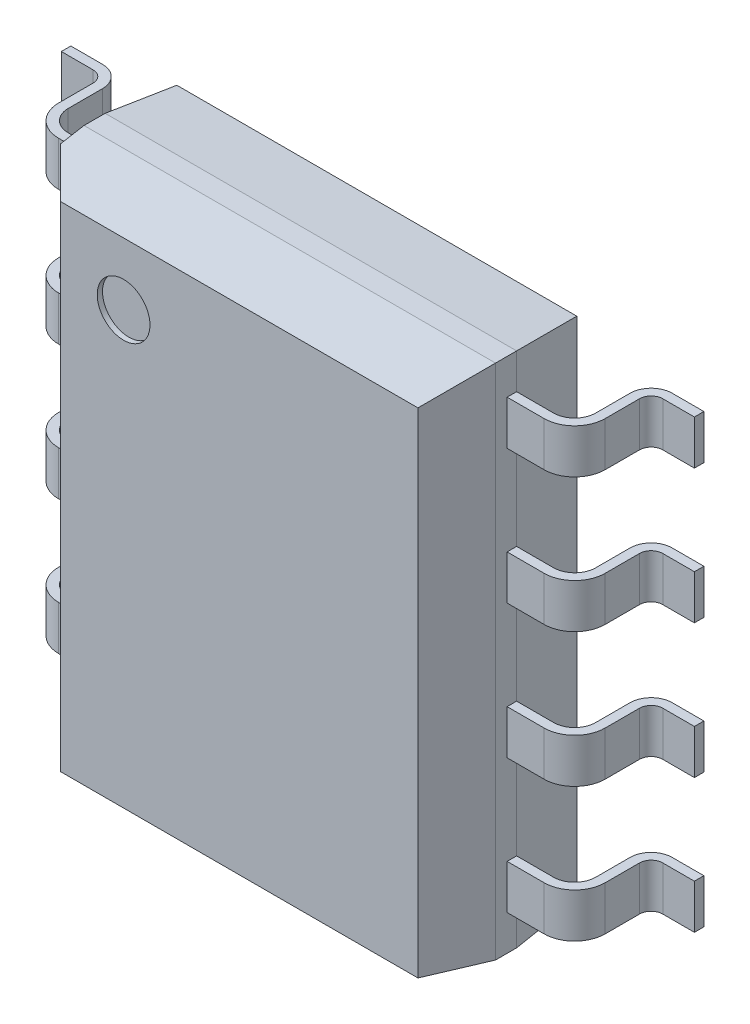
from build123d import *
from OCP.BRepFilletAPI import BRepFilletAPI_MakeChamfer

# Parameters (mm, degrees)
ESQUISSE2_W              = 3.9
ESQUISSE2_H              = 4.9
CORP_DEPTH               = 1.45
PIN_1_DEPTH              = 0.21
R_P_TITION_PIN_1_4_COUNT = 4
R_P_TITION_PIN_1_4_PITCH = 1.27
SYM_TRIE1_COPY_1_DEPTH   = 0.21
SYM_TRIE1_COPY_2_DEPTH   = 0.21
SYM_TRIE1_COPY_3_DEPTH   = 0.21
CHANFREIN4_SIZE          = 0.625
CHANFREIN4_SIZE2         = 0.110204363
CHANFREIN5_SIZE          = 0.625
CHANFREIN5_SIZE_2        = 0.054680415
ESQUISSE8_R              = 0.25
ENL_V_MAT_EXTRU_1_DEPTH  = 0.05
CHANFREIN7_SIZE          = 0.4


with BuildPart() as part:
    # Esquisse2 → corp (new body)
    with BuildSketch(Plane.XY.offset(0.1)):
        Rectangle(ESQUISSE2_W, ESQUISSE2_H)
    extrude(amount=CORP_DEPTH)

    # Esquisse6 → pin 1 (add, symmetric)
    with BuildSketch(Plane(origin=(0, 1.905, 0), x_dir=(-1, 0, 0), z_dir=(0, 1, 0))):
        with BuildLine():
            Line((1.95, 0.725), (2.3, 0.725))
            ThreePointArc((2.3, 0.725), (2.441421356, 0.666421356), (2.5, 0.525))
            Line((2.5, 0.525), (2.5, 0.2))
            ThreePointArc((2.5, 0.2), (2.558578644, 0.058578644), (2.7, 0))
            Line((2.7, 0), (3, 0))
            Line((3, 0), (3, 0.09))
            Line((3, 0.09), (2.7, 0.09))
            ThreePointArc((2.7, 0.09), (2.622218254, 0.122218254), (2.59, 0.2))
            Line((2.59, 0.2), (2.59, 0.525))
            ThreePointArc((2.59, 0.525), (2.505060967, 0.730060967), (2.3, 0.815))
            Line((2.3, 0.815), (1.95, 0.815))
            Line((1.95, 0.815), (1.95, 0.725))
        make_face()
    pin_1 = extrude(amount=PIN_1_DEPTH, both=True)

    # Répétition pin 1-4: pin 1 ×4
    with Locations(*[(0, -i * R_P_TITION_PIN_1_4_PITCH, 0) for i in range(1, R_P_TITION_PIN_1_4_COUNT)]):
        add(pin_1)

    # Symétrie1: pin 1 across plane
    add(pin_1.mirror(Plane(origin=(0, 0, 0), x_dir=(0, 0, 1), z_dir=(1, 0, 0))))

    # Symétrie1 copy 1 sketch → Symétrie1 copy 1 (add, symmetric)
    with BuildSketch(Plane(origin=(0, 0.635, 0), x_dir=(1, 0, 0), z_dir=(0, 1, 0))):
        with BuildLine():
            Line((1.95, -0.725), (2.3, -0.725))
            ThreePointArc((2.3, -0.725), (2.441421356, -0.666421356), (2.5, -0.525))
            Line((2.5, -0.525), (2.5, -0.2))
            ThreePointArc((2.5, -0.2), (2.558578644, -0.058578644), (2.7, 0))
            Line((2.7, 0), (3, 0))
            Line((3, 0), (3, -0.09))
            Line((3, -0.09), (2.7, -0.09))
            ThreePointArc((2.7, -0.09), (2.622218254, -0.122218254), (2.59, -0.2))
            Line((2.59, -0.2), (2.59, -0.525))
            ThreePointArc((2.59, -0.525), (2.505060967, -0.730060967), (2.3, -0.815))
            Line((2.3, -0.815), (1.95, -0.815))
            Line((1.95, -0.815), (1.95, -0.725))
        make_face()
    extrude(amount=SYM_TRIE1_COPY_1_DEPTH, both=True)

    # Symétrie1 copy 2 sketch → Symétrie1 copy 2 (add, symmetric)
    with BuildSketch(Plane(origin=(0, -0.635, 0), x_dir=(1, 0, 0), z_dir=(0, 1, 0))):
        with BuildLine():
            Line((1.95, -0.725), (2.3, -0.725))
            ThreePointArc((2.3, -0.725), (2.441421356, -0.666421356), (2.5, -0.525))
            Line((2.5, -0.525), (2.5, -0.2))
            ThreePointArc((2.5, -0.2), (2.558578644, -0.058578644), (2.7, 0))
            Line((2.7, 0), (3, 0))
            Line((3, 0), (3, -0.09))
            Line((3, -0.09), (2.7, -0.09))
            ThreePointArc((2.7, -0.09), (2.622218254, -0.122218254), (2.59, -0.2))
            Line((2.59, -0.2), (2.59, -0.525))
            ThreePointArc((2.59, -0.525), (2.505060967, -0.730060967), (2.3, -0.815))
            Line((2.3, -0.815), (1.95, -0.815))
            Line((1.95, -0.815), (1.95, -0.725))
        make_face()
    extrude(amount=SYM_TRIE1_COPY_2_DEPTH, both=True)

    # Symétrie1 copy 3 sketch → Symétrie1 copy 3 (add, symmetric)
    with BuildSketch(Plane(origin=(0, -1.905, 0), x_dir=(1, 0, 0), z_dir=(0, 1, 0))):
        with BuildLine():
            Line((1.95, -0.725), (2.3, -0.725))
            ThreePointArc((2.3, -0.725), (2.441421356, -0.666421356), (2.5, -0.525))
            Line((2.5, -0.525), (2.5, -0.2))
            ThreePointArc((2.5, -0.2), (2.558578644, -0.058578644), (2.7, 0))
            Line((2.7, 0), (3, 0))
            Line((3, 0), (3, -0.09))
            Line((3, -0.09), (2.7, -0.09))
            ThreePointArc((2.7, -0.09), (2.622218254, -0.122218254), (2.59, -0.2))
            Line((2.59, -0.2), (2.59, -0.525))
            ThreePointArc((2.59, -0.525), (2.505060967, -0.730060967), (2.3, -0.815))
            Line((2.3, -0.815), (1.95, -0.815))
            Line((1.95, -0.815), (1.95, -0.725))
        make_face()
    extrude(amount=SYM_TRIE1_COPY_3_DEPTH, both=True)

    # Chanfrein4: one chamfer whose edges measure the first distance from different faces: ONE call of the kernel's chamfer builder (chamfer() names one face for all edges)
    chanfrein4_edges_1 = [part.edges().sort_by_distance(p)[0] for p in [
        (1.95, 0, 1.55),
    ]]
    chanfrein4_side_1 = [part.faces().sort_by_distance(p)[0] for p in [
        (1.95, 0, 0.826195893),
    ]]
    chanfrein4_edges_2 = [part.edges().sort_by_distance(p)[0] for p in [
        (0, 2.45, 1.55),
    ]]
    chanfrein4_side_2 = [part.faces().sort_by_distance(p)[0] for p in [
        (0, 2.45, 0.825),
    ]]
    chanfrein4_edges_3 = [part.edges().sort_by_distance(p)[0] for p in [
        (0, -2.45, 1.55),
    ]]
    chanfrein4_side_3 = [part.faces().sort_by_distance(p)[0] for p in [
        (0, -2.45, 0.825),
    ]]
    chanfrein4 = BRepFilletAPI_MakeChamfer(part.part.solid().wrapped)
    for e in chanfrein4_edges_1:
        chanfrein4.Add(CHANFREIN4_SIZE, CHANFREIN4_SIZE2, e.wrapped, chanfrein4_side_1[0].wrapped)  # the first distance lies on this face
    for e in chanfrein4_edges_2:
        chanfrein4.Add(CHANFREIN4_SIZE, CHANFREIN4_SIZE2, e.wrapped, chanfrein4_side_2[0].wrapped)  # the first distance lies on this face
    for e in chanfrein4_edges_3:
        chanfrein4.Add(CHANFREIN4_SIZE, CHANFREIN4_SIZE2, e.wrapped, chanfrein4_side_3[0].wrapped)  # the first distance lies on this face
    add(Compound.cast(chanfrein4.Shape()), mode=Mode.REPLACE)

    # Chanfrein5
    chanfrein5_edges_1 = [part.edges().sort_by_distance(p)[0] for p in [
        (0, 2.45, 0.1),
    ]]
    chanfrein5_side_1 = [part.faces().sort_by_distance(p)[0] for p in [
        (0, 2.45, 0.101093608),
    ]]
    chanfrein5_edges_2 = [part.edges().sort_by_distance(p)[0] for p in [
        (1.95, 0, 0.1),
    ]]
    chanfrein5_side_2 = [part.faces().sort_by_distance(p)[0] for p in [
        (1.948906392, 0, 0.1),
    ]]
    chanfrein5_edges_3 = [part.edges().sort_by_distance(p)[0] for p in [
        (0, -2.45, 0.1),
    ]]
    chanfrein5_side_3 = [part.faces().sort_by_distance(p)[0] for p in [
        (0, -2.448906392, 0.1),
    ]]
    chanfrein5_edges_4 = [part.edges().sort_by_distance(p)[0] for p in [
        (-1.95, 0, 0.1),
    ]]
    chanfrein5_side_4 = [part.faces().sort_by_distance(p)[0] for p in [
        (-1.95, 0, 0.101093608),
    ]]
    chanfrein5 = BRepFilletAPI_MakeChamfer(part.part.solid().wrapped)
    for e in chanfrein5_edges_1:
        chanfrein5.Add(CHANFREIN5_SIZE - 0.0001, CHANFREIN5_SIZE_2 - 0.0001, e.wrapped, chanfrein5_side_1[0].wrapped)
    for e in chanfrein5_edges_2:
        chanfrein5.Add(CHANFREIN5_SIZE_2 - 0.0001, CHANFREIN5_SIZE - 0.0001, e.wrapped, chanfrein5_side_2[0].wrapped)
    for e in chanfrein5_edges_3:
        chanfrein5.Add(CHANFREIN5_SIZE_2 - 0.0001, CHANFREIN5_SIZE - 0.0001, e.wrapped, chanfrein5_side_3[0].wrapped)
    for e in chanfrein5_edges_4:
        chanfrein5.Add(CHANFREIN5_SIZE - 0.0001, CHANFREIN5_SIZE_2 - 0.0001, e.wrapped, chanfrein5_side_4[0].wrapped)
    add(Compound.cast(chanfrein5.Shape()), mode=Mode.REPLACE)  # a hair under: the kernel refuses the full size

    # Esquisse8 → Enlèv. mat.-Extru.1 (cut)
    with BuildSketch(Plane.XY.offset(1.55)):
        with Locations((-0.95, 1.75)):
            Circle(ESQUISSE8_R)
    extrude(amount=-ENL_V_MAT_EXTRU_1_DEPTH, mode=Mode.SUBTRACT)

    # Chanfrein7
    chanfrein7_edges = [part.edges().sort_by_distance(p)[0] for p in [
        (-1.95, 0, 1.55),
    ]]
    chamfer(chanfrein7_edges, length=CHANFREIN7_SIZE)


solid = part.part
